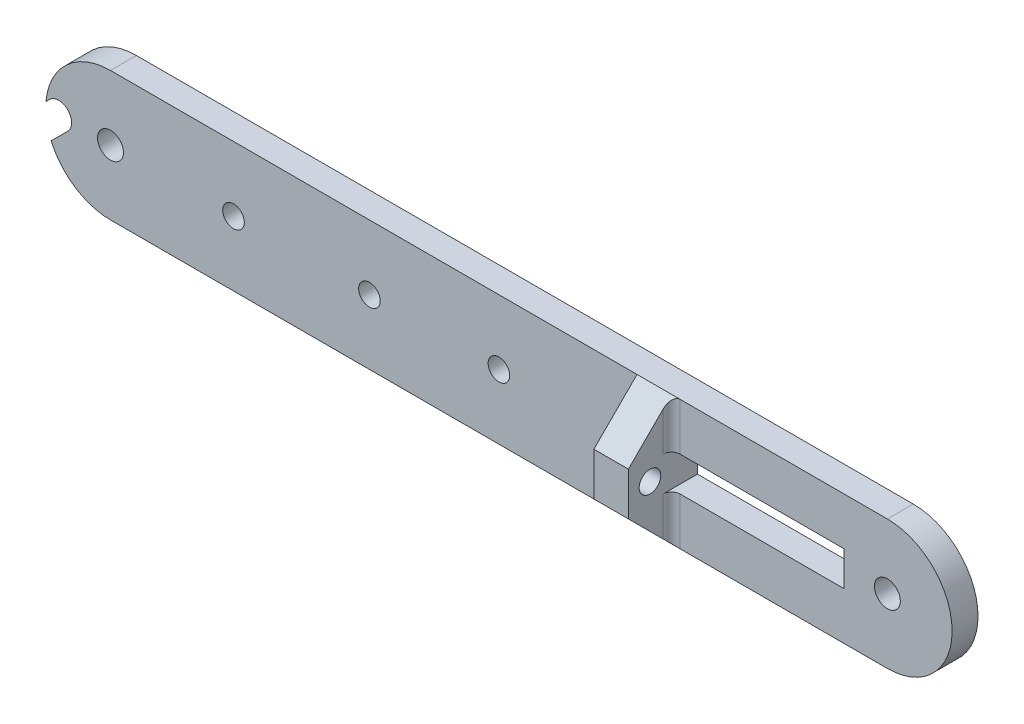
from build123d import *

# Parameters (mm, degrees)
ESQUISSE1_R             = 3
ESQUISSE1_R_2           = 2.5
ESQUISSE1_W             = 40
ESQUISSE1_H             = 8
BOSS_EXTRU_1_DEPTH      = 6
ESQUISSE2_R             = 2.5
BOSS_EXTRU_2_DEPTH      = 8
CONG_2_R                = 2
ENL_V_MAT_EXTRU_1_DEPTH = 4
ENL_V_START             = -10
ENL_V_MAT_EXTRU_4_DEPTH = 10


with BuildPart() as part:
    # Esquisse1 → Boss.-Extru.1 (new body)
    with BuildSketch(Plane.XY):
        with BuildLine():
            Line((90, -15), (-90, -15))
            ThreePointArc((-90, -15), (-105, 0), (-90, 15))
            Line((-90, 15), (90, 15))
            ThreePointArc((90, 15), (105, 0), (90, -15))
        make_face()
        with Locations((90, 0)):
            Circle(ESQUISSE1_R, mode=Mode.SUBTRACT)
        with Locations((-90, 0)):
            Circle(ESQUISSE1_R, mode=Mode.SUBTRACT)
        Circle(ESQUISSE1_R_2, mode=Mode.SUBTRACT)
        with Locations((-61.5, 0)):
            Circle(ESQUISSE1_R_2, mode=Mode.SUBTRACT)
        with Locations((-30, 0)):
            Circle(ESQUISSE1_R_2, mode=Mode.SUBTRACT)
        with Locations((60, 0)):
            Rectangle(ESQUISSE1_W, ESQUISSE1_H, mode=Mode.SUBTRACT)
    extrude(amount=BOSS_EXTRU_1_DEPTH)

    # Esquisse2 → Boss.-Extru.2 (add)
    with BuildSketch(Plane(origin=(40, 0, 0), x_dir=(0, 0, -1), z_dir=(1, 0, 0))):
        Polygon((-16, 5), (-16, -5), (-6, -15), (-6, -5), (-6, 5), (-6, 15), align=None)
        with Locations((-11, 0)):
            Circle(ESQUISSE2_R, mode=Mode.SUBTRACT)
    extrude(amount=-BOSS_EXTRU_2_DEPTH)

    # Congé2
    cong_2_edges = [part.edges().sort_by_distance(p)[0] for p in [
        (40, 9.5, 6),
        (40, -9.5, 6),
    ]]
    fillet(cong_2_edges, radius=CONG_2_R)

    # Esquisse3 → Enlèv. mat.-Extru.1 (cut)
    with BuildSketch(Plane.ZY.offset(-32)):
        Polygon((11, 4), (14.464101615, 2), (14.464101615, -2), (11, -4), (7.535898385, -2), (7.535898385, 2), align=None)
    extrude(amount=-ENL_V_MAT_EXTRU_1_DEPTH, mode=Mode.SUBTRACT)

    # Esquisse4 → Enlèv. mat.-Extru.4 (cut)
    with BuildSketch(Plane.XY.offset(6).offset(ENL_V_START)):
        with BuildLine():
            Line((-103.750652313, -5.993293), (-99.878679656, -2.121320344))
            ThreePointArc((-99.878679656, -2.121320344), (-99.878679656, 2.121320344), (-104.121320344, 2.121320344))
            Line((-104.121320344, 2.121320344), (-104.94364809, 1.298992597))
            ThreePointArc((-104.94364809, 1.298992597), (-104.803211685, -2.421760475), (-103.750652313, -5.993293))
        make_face()
    extrude(amount=ENL_V_MAT_EXTRU_4_DEPTH, mode=Mode.SUBTRACT)


solid = part.part
